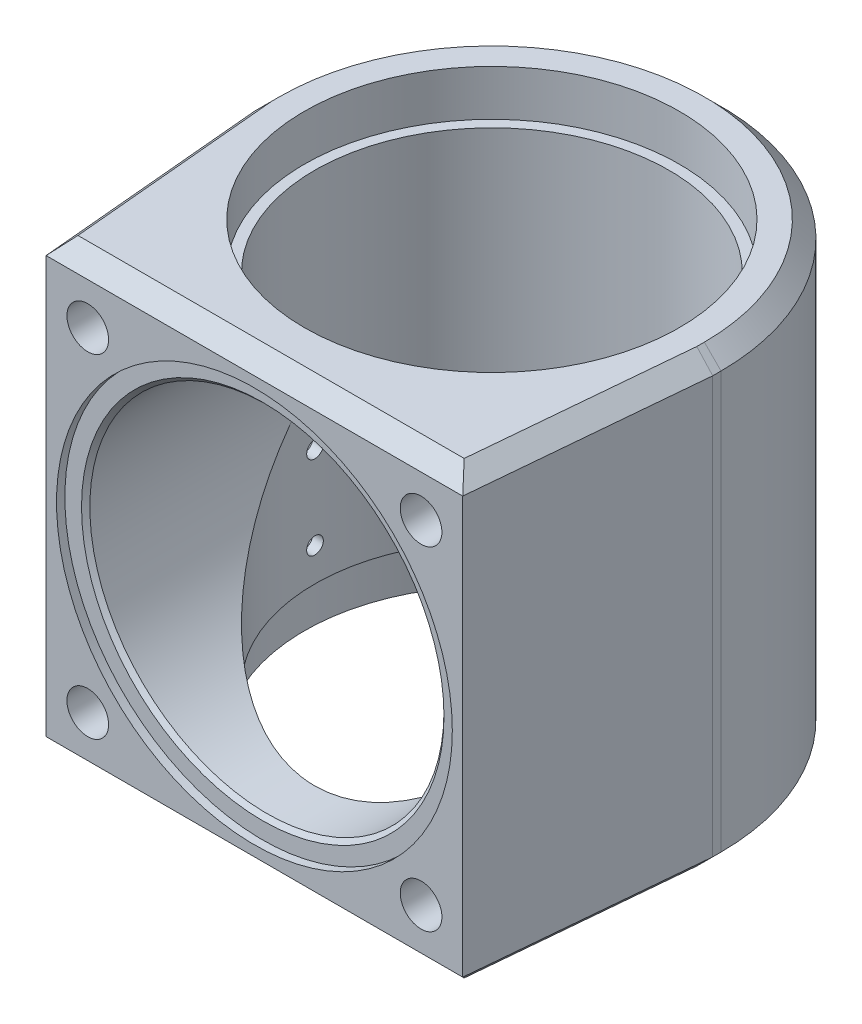
from build123d import *

# Parameters (mm, degrees)
EXTRUDE_1_DEPTH          = 108
CHAMFER_1_SIZE           = 55
CHAMFER_1_SIZE2          = 5
CHAMFER_2_SIZE           = 5
CHAMFER_2_SIZE2          = 55
CHAMFER_3_SIZE           = 4
SKETCH_2_R               = 42.5
CUT_EXTRUDE_1_DEPTH      = 108
SKETCH_3_R               = 45
CUT_EXTRUDE_2_DEPTH      = 11
CUT_EXTRUDE_START        = -97
SKETCH_3_2_R             = 45
CUT_EXTRUDE_3_DEPTH      = 11
SKETCH_4_R               = 5
CUT_EXTRUDE_4_DEPTH      = 21
SKETCH_8_R               = 47.5
CUT_EXTRUDE_5_DEPTH      = 2
CUT_EXTRUDE_6_REACH      = 165.673
CUT_EXTRUDE_6_END_RADIUS = 42.5
SKETCH_9_R               = 42.5
CHAMFER_4_SIZE           = 1


with BuildPart() as part:
    # 草图1 → 凸台-拉伸1 (new body)
    with BuildSketch(Plane(origin=(0, 0, 0), x_dir=(1, 0, 0), z_dir=(0, 1, 0))):
        with BuildLine():
            Line((-55, 0), (55, 0))
            Line((55, 0), (55, 57))
            ThreePointArc((55, 57), (0, 112), (-55, 57))
            Line((-55, 57), (-55, 0))
        make_face()
    extrude(amount=EXTRUDE_1_DEPTH)

    # 倒角1
    chamfer_1_edges = [part.edges().sort_by_distance(p)[0] for p in [
        (-55, 54, 0),
    ]]
    chamfer_1_side = [part.faces().sort_by_distance(p)[0] for p in [
        (-55, 54, -28.5),
    ]]
    chamfer(chamfer_1_edges, length=CHAMFER_1_SIZE, length2=CHAMFER_1_SIZE2, reference=chamfer_1_side[0])

    # 倒角2
    chamfer_2_edges = [part.edges().sort_by_distance(p)[0] for p in [
        (55, 54, 0),
    ]]
    chamfer_2_side = [part.faces().sort_by_distance(p)[0] for p in [
        (2.5, 54, 0),
    ]]
    chamfer(chamfer_2_edges, length=CHAMFER_2_SIZE, length2=CHAMFER_2_SIZE2, reference=chamfer_2_side[0])

    # 倒角3
    # the kernel refuses this chamfer: 4 mm, written as the material it takes off along each edge
    with BuildSketch(Plane(origin=(-55, 108, -57), x_dir=(-0.027495876610585647, -0.9996219169112968, 0), z_dir=(0, 0, 1)), Plane(origin=(55, 0, -44.713268048), x_dir=(-0.9996219169112968, -0.02749587661058639, 0), z_dir=(0, 0, -1)), Plane(origin=(55, 108, -44.713268048), x_dir=(0.027495876610585647, -0.9996219169112968, 0), z_dir=(0, 0, -1)), Plane(origin=(-55, 0, -57), x_dir=(0.9996219169112968, -0.02749587661058639, 0), z_dir=(0, 0, 1))) as chamfer_3_piece_1:
        Polygon((CHAMFER_3_SIZE * 0.999621916911, CHAMFER_3_SIZE * 0.0274958766106), (-CHAMFER_3_SIZE * 0.0274958766106, CHAMFER_3_SIZE * 0.999621916911), (0, 0), align=None)
    extrude(amount=12.286731952, mode=Mode.SUBTRACT)
    with BuildSketch(Plane(origin=(-60.286731952, 0, 0), x_dir=(0, -0.027495876610586372, -0.9996219169112968), z_dir=(1, 0, 0)), Plane(origin=(-60.286731952, 108, 0), x_dir=(0, -0.9996219169112968, 0.02749587661058639), z_dir=(1, 0, 0))) as chamfer_3_piece_2:
        Polygon((CHAMFER_3_SIZE * 0.999621916911, CHAMFER_3_SIZE * 0.0274958766106), (-CHAMFER_3_SIZE * 0.0274958766106, CHAMFER_3_SIZE * 0.999621916911), (0, 0), align=None)
    extrude(amount=120.573463904, mode=Mode.SUBTRACT)
    with BuildSketch(Plane(origin=(-55.931316952, 0, -65.244486468), x_dir=(0.995516676088184, -0.027495876610586417, -0.09050151600801698), z_dir=(0.09053574604251878, 0, 0.9958932064677039)), Plane(origin=(-55.931316952, 108, -65.244486468), x_dir=(-0.027382956722356327, -0.9996219169112968, 0.0024893597020324005), z_dir=(0.09053574604251878, 0, 0.9958932064677039)), Plane(origin=(49.068683048, 0, 10.244486468), x_dir=(-0.995516676088184, -0.027495876610586358, -0.09050151600801698), z_dir=(0.09053574604251878, 0, -0.9958932064677039)), Plane(origin=(49.068683048, 108, 10.244486468), x_dir=(0.027382956722356445, -0.9996219169112968, 0.0024893597020324114), z_dir=(0.09053574604251878, 0, -0.9958932064677039))) as chamfer_3_piece_3:
        Polygon((CHAMFER_3_SIZE * 0.999621916911, CHAMFER_3_SIZE * 0.0274958766106), (-CHAMFER_3_SIZE * 0.0274958766106, CHAMFER_3_SIZE * 0.999621916911), (0, 0), align=None)
    extrude(amount=75.80026899, mode=Mode.SUBTRACT)
    with BuildSketch(Plane(origin=(0, 0, -57), x_dir=(1, 0, 0), z_dir=(0, 0, 1))) as chamfer_3_piece_4:
        Polygon((55 - CHAMFER_3_SIZE, 0), (55, CHAMFER_3_SIZE), (55, 0), align=None)
    revolve(axis=Axis((0, 0, -57), (0, 1, 0)), revolution_arc=180, mode=Mode.SUBTRACT)
    with BuildSketch(Plane(origin=(0, 108, -57), x_dir=(1, 0, 0), z_dir=(0, 0, 1))) as chamfer_3_piece_5:
        Polygon((55, -CHAMFER_3_SIZE), (55 - CHAMFER_3_SIZE, 0), (55, 0), align=None)
    revolve(axis=Axis((0, 108, -57), (0, 1, 0)), revolution_arc=180, mode=Mode.SUBTRACT)

    # 草图2 → 切除-拉伸1 (cut)
    with BuildSketch(Plane(origin=(0, 108, 0), x_dir=(1, 0, 0), z_dir=(0, 1, 0))):
        with Locations(Location((0, 57, 0), (0, 0, 270))):
            Circle(SKETCH_2_R)
    extrude(amount=-CUT_EXTRUDE_1_DEPTH, mode=Mode.SUBTRACT)

    # 草图3 → 切除-拉伸2 (cut)
    with BuildSketch(Plane(origin=(0, 108, 0), x_dir=(1, 0, 0), z_dir=(0, 1, 0))):
        with Locations(Location((0, 57, 0), (0, 0, 270))):
            Circle(SKETCH_3_R)
    extrude(amount=-CUT_EXTRUDE_2_DEPTH, mode=Mode.SUBTRACT)

    # 草图3<2> → 切除-拉伸3 (cut)
    with BuildSketch(Plane(origin=(0, 108, 0), x_dir=(1, 0, 0), z_dir=(0, 1, 0)).offset(CUT_EXTRUDE_START)):
        with Locations(Location((0, 57, 0), (0, 0, 270))):
            Circle(SKETCH_3_2_R)
    extrude(amount=-CUT_EXTRUDE_3_DEPTH, mode=Mode.SUBTRACT)

    # 草图4 → 切除-拉伸4 (cut)
    with BuildSketch(Plane.XY):
        with Locations((40, 94)):
            Circle(SKETCH_4_R)
        with Locations((40, 14)):
            Circle(SKETCH_4_R)
        with Locations((-40, 14)):
            Circle(SKETCH_4_R)
        with Locations((-40, 94)):
            Circle(SKETCH_4_R)
    extrude(amount=-CUT_EXTRUDE_4_DEPTH, mode=Mode.SUBTRACT)

    # 草图6 → 切除-旋转1 (revolve, cut)
    with BuildSketch(Plane(origin=(0, 19, 0), x_dir=(-1, 0, 0), z_dir=(0, -1, 0))):
        Polygon((55, 57), (55, 52), (45, 52), (45, 55), (35, 55), (35, 57), align=None)
    revolve(axis=Axis((-55, 19, -57), (1, 0, 0)), mode=Mode.SUBTRACT)

    # 草图7 → 切除-旋转2 (revolve, cut)
    with BuildSketch(Plane(origin=(0, 39, 0), x_dir=(-1, 0, 0), z_dir=(0, -1, 0))):
        Polygon((35, 55), (35, 57), (55, 57), (55, 52), (45, 52), (45, 55), align=None)
    revolve(axis=Axis((-55, 39, -57), (1, 0, 0)), mode=Mode.SUBTRACT)

    # 草图8 → 切除-拉伸5 (cut)
    with BuildSketch(Plane.XY):
        with Locations((0, 54)):
            Circle(SKETCH_8_R)
    extrude(amount=-CUT_EXTRUDE_5_DEPTH, mode=Mode.SUBTRACT)

    # 切除-拉伸6: up to this cylinder (the profile starts outside it)
    cut_extrude_6_end = Plane(origin=(0, 54, -57), z_dir=(0, 1, 0)) * Cylinder(CUT_EXTRUDE_6_END_RADIUS, 417.346, mode=Mode.PRIVATE)
    # 草图9 → 切除-拉伸6 (cut, up to the surface)
    with BuildSketch(Plane.XY.offset(-2), mode=Mode.PRIVATE) as cut_extrude_6_sk1:
        with Locations((0, 54)):
            Circle(SKETCH_9_R)
    cut_extrude_6_tool1 = extrude(cut_extrude_6_sk1.sketch, amount=-CUT_EXTRUDE_6_REACH, mode=Mode.PRIVATE) - cut_extrude_6_end
    add(cut_extrude_6_tool1.solids().sort_by_distance((0, 54, -2))[0], mode=Mode.SUBTRACT)

    # 倒角4
    chamfer_4_edges = [part.edges().sort_by_distance(p)[0] for p in [
        (-42.5, 54, -2),
    ]]
    chamfer(chamfer_4_edges, length=CHAMFER_4_SIZE)


solid = part.part
